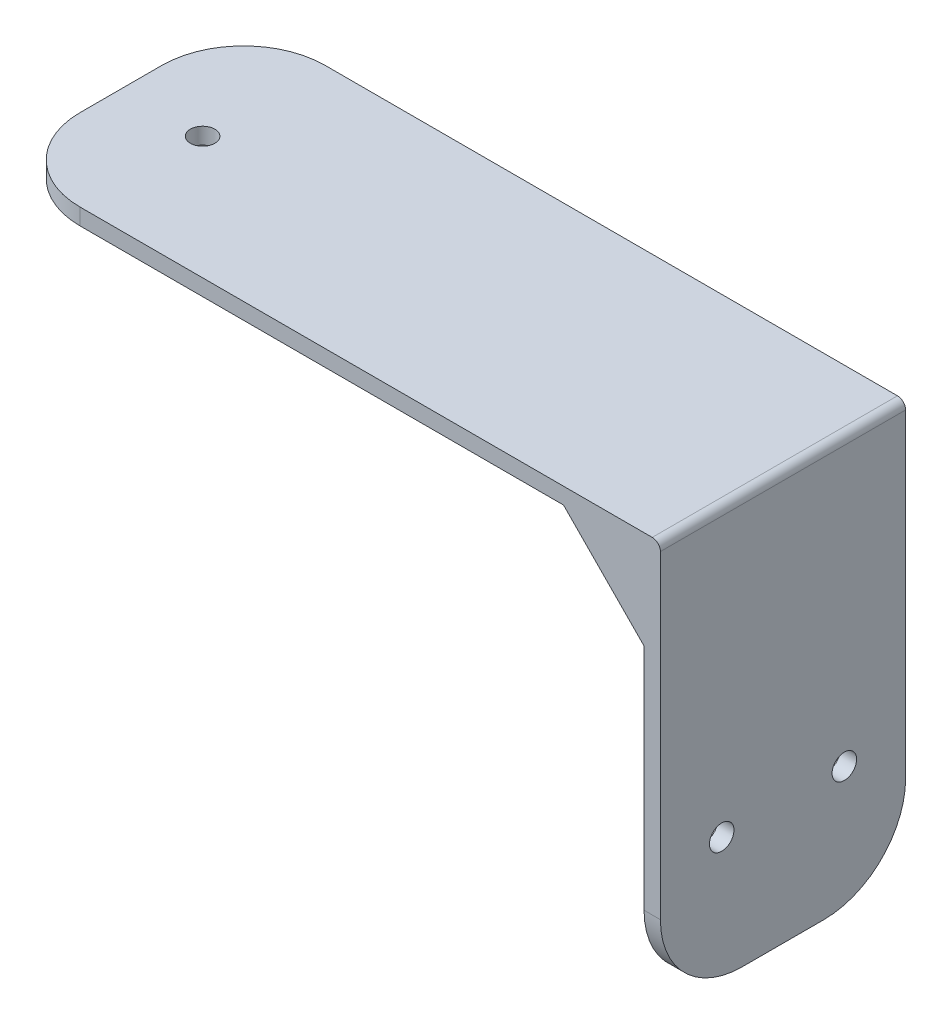
from build123d import *

# Parameters (mm, degrees)
SKETCH1_W           = 80
SKETCH1_H           = 30
SKETCH1_R           = 1.5
BOSS_EXTRUDE1_DEPTH = 2
SKETCH2_W           = 2
SKETCH2_H           = 30
BOSS_EXTRUDE2_DEPTH = 50
SKETCH3_R           = 1.5
CUT_EXTRUDE1_DEPTH  = 70
FILLET1_R           = 1
FILLET2_R           = 10
BOSS_EXTRUDE3_DEPTH = 2


with BuildPart() as part:
    # Sketch1 → Boss-Extrude1 (new body)
    with BuildSketch(Plane(origin=(0, 0, 0), x_dir=(1, 0, 0), z_dir=(0, 1, 0))):
        with Locations((40, 15)):
            Rectangle(SKETCH1_W, SKETCH1_H)
        with Locations((10, 15)):
            Circle(SKETCH1_R, mode=Mode.SUBTRACT)
    extrude(amount=BOSS_EXTRUDE1_DEPTH)

    # Sketch2 → Boss-Extrude2 (add)
    with BuildSketch(Plane(origin=(0, 2, 0), x_dir=(1, 0, 0), z_dir=(0, 1, 0))):
        with Locations((80, 15)):
            Rectangle(SKETCH2_W, SKETCH2_H)
    extrude(amount=-BOSS_EXTRUDE2_DEPTH)

    # Sketch3 → Cut-Extrude1 (cut)
    with BuildSketch(Plane.ZY.offset(-79)):
        with Locations((-22.5, -33)):
            Circle(SKETCH3_R)
        with Locations((-7.5, -33)):
            Circle(SKETCH3_R)
    extrude(amount=-CUT_EXTRUDE1_DEPTH, mode=Mode.SUBTRACT)

    # Fillet1
    fillet1_edges = [part.edges().sort_by_distance(p)[0] for p in [
        (79, 0, -15),
        (81, 2, -15),
    ]]
    fillet(fillet1_edges, radius=FILLET1_R)

    # Fillet2
    fillet2_edges = [part.edges().sort_by_distance(p)[0] for p in [
        (80, -48, 0),
        (80, -48, -30),
        (0, 1, 0),
        (0, 1, -30),
    ]]
    fillet(fillet2_edges, radius=FILLET2_R)

    # Sketch4 → Boss-Extrude3 (add)
    with BuildSketch(Plane.XY):
        with BuildLine():
            Line((78, 0), (69.151094276, 0))
            Line((69.151094276, 0), (79, -10))
            Line((79, -10), (79, -1))
            ThreePointArc((79, -1), (78.707106781, -0.292893219), (78, 0))
        make_face()
    boss_extrude3 = extrude(amount=-BOSS_EXTRUDE3_DEPTH)

    # Mirror1: Boss-Extrude3 across plane
    add(boss_extrude3.mirror(Plane.XY.offset(-15)))


solid = part.part
